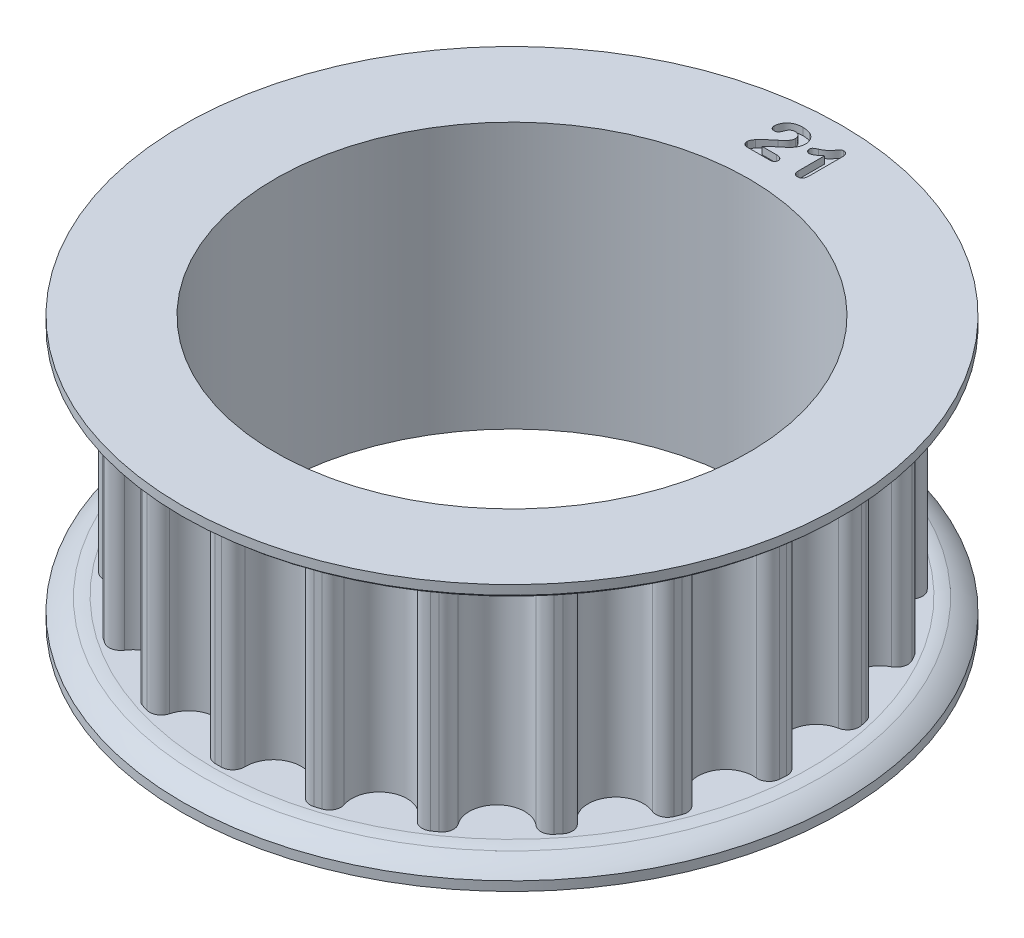
from build123d import *

# Parameters (mm, degrees)
SKETCH1_R               = 16.13976871
TOOTHOD_DEPTH           = 6.0325
TOOTHPROFILE_DEPTH      = 26.817600451
TOOTHPATTERN_COUNT      = 21
BORE_DEPTH              = 27.629782155
BORE_DEPTH_BACK         = 27.629782155
SKETCH7_R               = 13.0175
LARGE_TOOTH_COUNT_DEPTH = 0.4


with BuildPart() as part:
    # Sketch1 → ToothOD (new, symmetric)
    with BuildSketch(Plane(origin=(0, 0, 0), x_dir=(1, 0, 0), z_dir=(0, 1, 0))):
        Circle(SKETCH1_R)
    extrude(amount=TOOTHOD_DEPTH, both=True)

    # Sketch2 → ToothProfile (cut, through all)
    with BuildSketch(Plane(origin=(0, 6.0325, 0), x_dir=(1, 0, 0), z_dir=(0, 1, 0))):
        with BuildLine():
            ThreePointArc((-1.514819148, 15.428848418), (0, 14.07976871), (1.514819148, 15.428848418))
            ThreePointArc((1.514819148, 15.428848418), (1.757165873, 15.857950358), (2.233452437, 15.984486987))
            ThreePointArc((2.233452437, 15.984486987), (0, 16.13976871), (-2.233452437, 15.984486987))
            ThreePointArc((-2.233452437, 15.984486987), (-1.757165873, 15.857950358), (-1.514819148, 15.428848418))
        make_face()
    toothprofile = extrude(amount=-TOOTHPROFILE_DEPTH, mode=Mode.SUBTRACT)

    # ToothPattern: ToothProfile ×21 about axis
    toothpattern_axis = Axis((0, 6.0325, 0), (0, -1, 0))
    for i in range(1, TOOTHPATTERN_COUNT):
        add(toothprofile.rotate(toothpattern_axis, i * 360 / TOOTHPATTERN_COUNT), mode=Mode.SUBTRACT)

    # Sketch4 → Flange (revolve)
    with BuildSketch(Plane.XY):
        with BuildLine():
            Line((0, -6.0325), (16.39376871, -6.0325))
            ThreePointArc((16.39376871, -6.0325), (16.7195247, -6.058122571), (17.039341039, -6.125137424))
            ThreePointArc((17.039341039, -6.125137424), (17.607069616, -6.406697125), (18.10826871, -6.7945))
            Line((18.10826871, -6.7945), (18.10826871, -7.3025))
            Line((18.10826871, -7.3025), (0, -7.3025))
            Line((0, -7.3025), (0, -6.0325))
        make_face()
        with BuildLine():
            Line((18.10826871, 7.3025), (18.10826871, 6.7945))
            ThreePointArc((18.10826871, 6.7945), (17.607069616, 6.406697125), (17.039341039, 6.125137424))
            ThreePointArc((17.039341039, 6.125137424), (16.7195247, 6.058122571), (16.39376871, 6.0325))
            Line((16.39376871, 6.0325), (0, 6.0325))
            Line((0, 6.0325), (0, 7.3025))
            Line((0, 7.3025), (18.10826871, 7.3025))
        make_face()
    revolve(axis=Axis((0, 7.858125, 0), (0, -1, 0)))

    # Sketch7 → Bore (cut, two sides: drawn at the far end of the back side and taken through both)
    with BuildSketch(Plane.XZ.offset(-BORE_DEPTH_BACK)):
        Circle(SKETCH7_R)
    extrude(amount=BORE_DEPTH + BORE_DEPTH_BACK, mode=Mode.SUBTRACT)

    # Sketch9 → Large Tooth Count (cut)
    with BuildSketch(Plane(origin=(0, 7.3025, 0), x_dir=(1, 0, 0), z_dir=(0, 1, 0))):
        with BuildLine():
            Line((-1.17475, 14.918306129), (-0.380503906, 14.918306129))
            add(Edge.make_bspline(
                [(-0.380503906, 14.918306129), (-0.355804804, 14.917682907), (-0.309030284, 14.916502664), (-0.243428178, 14.904118762), (-0.186528488, 14.883888919), (-0.139033156, 14.85562971), (-0.101393999, 14.82140095), (-0.074037597, 14.782715406), (-0.05719802, 14.739856105), (-0.055122246, 14.709761932), (-0.054074219, 14.694567848)],
                knots=[0, 0, 0, 0, 1.343135754, 2.543595783, 3.617176489, 4.61442092, 5.531765965, 6.365790276, 7.174912707, 8, 8, 8, 8], degree=3))
            add(Edge.make_bspline(
                [(-0.054074219, 14.694567848), (-0.054802085, 14.680914227), (-0.056261987, 14.653528763), (-0.069398545, 14.613617613), (-0.090815368, 14.575898238), (-0.119929687, 14.540631431), (-0.158258195, 14.509803266), (-0.207543811, 14.48879411), (-0.265920631, 14.476030606), (-0.30799964, 14.474578885), (-0.330398438, 14.473806129)],
                knots=[0, 0, 0, 0, 0.824179157, 1.653080055, 2.512971333, 3.436438535, 4.405072091, 5.457340227, 6.646533722, 8, 8, 8, 8], degree=3))
            Line((-0.330398438, 14.473806129), (-1.536898438, 14.473806129))
            add(Edge.make_bspline(
                [(-1.536898438, 14.473806129), (-1.558472167, 14.474747701), (-1.599630029, 14.476544009), (-1.658082736, 14.490418249), (-1.709286326, 14.514606965), (-1.752624345, 14.547943859), (-1.786632726, 14.588103917), (-1.811741068, 14.63229278), (-1.827332638, 14.680148984), (-1.829165097, 14.713470809), (-1.830089844, 14.730286598)],
                knots=[0, 0, 0, 0, 1.188346208, 2.267099395, 3.286301641, 4.287122075, 5.25691743, 6.166969209, 7.074964888, 8, 8, 8, 8], degree=3))
            add(Edge.make_bspline(
                [(-1.830089844, 14.730286598), (-1.82945326, 14.742077618), (-1.82809279, 14.767276672), (-1.81802838, 14.806856447), (-1.803891207, 14.850945351), (-1.783601434, 14.897581453), (-1.760792521, 14.944322087), (-1.735670977, 14.987318721), (-1.709387952, 15.025259736), (-1.689753106, 15.047140248), (-1.680269531, 15.057708473)],
                knots=[0, 0, 0, 0, 0.772497252, 1.650934469, 2.665768415, 3.807487169, 4.98083678, 6.074173258, 7.069831195, 8, 8, 8, 8], degree=3))
            add(Edge.make_bspline(
                [(-1.680269531, 15.057708473), (-1.644035421, 15.094730938), (-1.574101955, 15.166185965), (-1.470555323, 15.267208505), (-1.374109598, 15.360134187), (-1.297309351, 15.431321971), (-1.23997077, 15.483451958), (-1.20075337, 15.517962836), (-1.165078366, 15.549658695), (-1.131700628, 15.577053388), (-1.102112959, 15.602111382), (-1.075294446, 15.623421764), (-1.051577987, 15.641444775), (-1.036380199, 15.651754679), (-1.029394531, 15.656493629)],
                knots=[0, 0, 0, 0, 2.106460972, 4.065564631, 5.88232778, 7.552435621, 8.323665149, 9.033433807, 9.676767744, 10.26395234, 10.78914621, 11.253325952, 11.656791058, 12, 12, 12, 12], degree=3))
            add(Edge.make_bspline(
                [(-1.029394531, 15.656493629), (-1.008100325, 15.67169795), (-0.966690791, 15.701264859), (-0.908607017, 15.747117736), (-0.856992368, 15.79358195), (-0.81034503, 15.839192122), (-0.769506063, 15.885410695), (-0.734191479, 15.932030152), (-0.704185654, 15.978984079), (-0.679139431, 16.025994093), (-0.660078043, 16.073185347), (-0.644945306, 16.119397262), (-0.637105315, 16.165385255), (-0.635693618, 16.19572389), (-0.635, 16.210630348)],
                knots=[0, 0, 0, 0, 1.334834965, 2.595771614, 3.772830874, 4.876488071, 5.92253324, 6.916378838, 7.85720954, 8.762924605, 9.629317751, 10.451189837, 11.239014127, 12, 12, 12, 12], degree=3))
            add(Edge.make_bspline(
                [(-0.635, 16.210630348), (-0.63557668, 16.226050246), (-0.636701897, 16.256137525), (-0.645411493, 16.30007768), (-0.659757467, 16.341594223), (-0.680292652, 16.380073347), (-0.705082453, 16.415594933), (-0.734491604, 16.446994199), (-0.768185045, 16.474008719), (-0.80541105, 16.49670422), (-0.845448109, 16.515217774), (-0.88806427, 16.527943578), (-0.932491171, 16.536334234), (-0.9628789, 16.537144845), (-0.978296875, 16.537556129)],
                knots=[0, 0, 0, 0, 1.048524963, 2.045880207, 3.035079073, 4.026514865, 5.003545842, 5.974663832, 6.942844473, 7.932746918, 8.934660944, 9.934741294, 10.952139253, 12, 12, 12, 12], degree=3))
            add(Edge.make_bspline(
                [(-0.978296875, 16.537556129), (-0.992402558, 16.537188342), (-1.020219282, 16.536463056), (-1.060692036, 16.527427481), (-1.099462324, 16.514049004), (-1.136388025, 16.495029907), (-1.171419292, 16.470300207), (-1.204536992, 16.440358877), (-1.236368104, 16.405392784), (-1.254607433, 16.378719691), (-1.264046875, 16.364915504)],
                knots=[0, 0, 0, 0, 0.968576666, 1.910054901, 2.83824492, 3.784521401, 4.756498814, 5.779585462, 6.850863807, 8, 8, 8, 8], degree=3))
            add(Edge.make_bspline(
                [(-1.264046875, 16.364915504), (-1.265923225, 16.361136697), (-1.271503607, 16.349898289), (-1.279747767, 16.325746732), (-1.294286291, 16.290144695), (-1.309714662, 16.24377585), (-1.329529783, 16.193966006), (-1.352612707, 16.145900043), (-1.379353709, 16.103035228), (-1.406692224, 16.06309583), (-1.442160272, 16.030136185), (-1.487192125, 16.00725067), (-1.541277164, 15.993950025), (-1.580142304, 15.992582957), (-1.600894531, 15.991853004)],
                knots=[0, 0, 0, 0, 0.277128514, 0.824197545, 1.674066046, 2.805212172, 4.034469565, 5.196326461, 6.303667431, 7.353778336, 8.369399301, 9.448751033, 10.637748383, 12, 12, 12, 12], degree=3))
            add(Edge.make_bspline(
                [(-1.600894531, 15.991853004), (-1.616180684, 15.99259299), (-1.646086916, 15.994040719), (-1.68905495, 16.006073427), (-1.727403458, 16.027127402), (-1.761350035, 16.054956975), (-1.789657559, 16.089748814), (-1.808718746, 16.131489991), (-1.821206006, 16.1779962), (-1.822480726, 16.210873124), (-1.823144531, 16.227993629)],
                knots=[0, 0, 0, 0, 1.006577142, 1.969294067, 2.910545259, 3.870728958, 4.847838899, 5.837573602, 6.873926541, 8, 8, 8, 8], degree=3))
            add(Edge.make_bspline(
                [(-1.823144531, 16.227993629), (-1.822436115, 16.248538841), (-1.821005637, 16.290025035), (-1.810431458, 16.352630607), (-1.794110349, 16.416281427), (-1.770911294, 16.480516181), (-1.740660207, 16.543530658), (-1.704619525, 16.604649314), (-1.660645532, 16.661587262), (-1.611959456, 16.716617549), (-1.555478935, 16.766798642), (-1.491996993, 16.812241117), (-1.421387058, 16.852186284), (-1.34403892, 16.887246276), (-1.259686643, 16.915535948), (-1.168395357, 16.935570638), (-1.07060184, 16.948364376), (-1.003143515, 16.949645717), (-0.968375, 16.950306129)],
                knots=[0, 0, 0, 0, 0.79066067, 1.596552158, 2.438066046, 3.318094126, 4.22076533, 5.12585777, 6.043865989, 6.985993145, 7.950839248, 8.945468985, 9.986194989, 11.068910188, 12.21037173, 13.404260134, 14.66213667, 16, 16, 16, 16], degree=3))
            add(Edge.make_bspline(
                [(-0.968375, 16.950306129), (-0.94620917, 16.950002663), (-0.902834011, 16.949408825), (-0.839122333, 16.945278577), (-0.778137309, 16.939154316), (-0.719915766, 16.929476196), (-0.66430709, 16.917922285), (-0.611582715, 16.902744768), (-0.561396312, 16.885744397), (-0.529574805, 16.871815781), (-0.513953125, 16.864978004)],
                knots=[0, 0, 0, 0, 1.141710532, 2.234153931, 3.287715026, 4.297387598, 5.273071892, 6.211454997, 7.121975032, 8, 8, 8, 8], degree=3))
            add(Edge.make_bspline(
                [(-0.513953125, 16.864978004), (-0.491896335, 16.854149952), (-0.448534873, 16.832863075), (-0.388351733, 16.794251079), (-0.333414408, 16.751706434), (-0.284744221, 16.704257082), (-0.241572543, 16.653370063), (-0.202858126, 16.599839334), (-0.170697232, 16.542171962), (-0.143498456, 16.482138415), (-0.122200371, 16.420139983), (-0.106821368, 16.357390392), (-0.096837838, 16.29412865), (-0.095778904, 16.251677233), (-0.09525, 16.230474098)],
                knots=[0, 0, 0, 0, 1.100471427, 2.163417708, 3.198242748, 4.209796447, 5.203380146, 6.186404149, 7.165424876, 8.157237974, 9.136931722, 10.098602738, 11.050312444, 12, 12, 12, 12], degree=3))
            add(Edge.make_bspline(
                [(-0.09525, 16.230474098), (-0.096462028, 16.197141175), (-0.098858892, 16.131223173), (-0.118864267, 16.034457512), (-0.151758446, 15.942029698), (-0.197278591, 15.855719123), (-0.248999823, 15.776702812), (-0.301239177, 15.704620585), (-0.355006619, 15.642557968), (-0.401386401, 15.596248496), (-0.441284775, 15.561653539), (-0.47465706, 15.532680027), (-0.512217664, 15.500623943), (-0.554096375, 15.465086342), (-0.600705101, 15.42675813), (-0.651145912, 15.384362227), (-0.706225706, 15.339431932), (-0.764070622, 15.292302698), (-0.82203457, 15.245004728), (-0.876250701, 15.198275543), (-0.926555501, 15.154861339), (-0.971965666, 15.113417914), (-1.012777395, 15.074343396), (-1.049949883, 15.038386386), (-1.081487811, 15.003932987), (-1.101026322, 14.981830887), (-1.110257813, 14.97138816)],
                knots=[0, 0, 0, 0, 1.436599664, 2.840968415, 4.241909903, 5.655071448, 7.037977016, 8.313294046, 9.491515882, 10.57584574, 11.13676856, 11.768818006, 12.482089669, 13.266552005, 14.137751607, 15.08474532, 16.108481255, 17.203478555, 18.302996106, 19.33499709, 20.290440541, 21.168908746, 21.986178864, 22.727567017, 23.398805086, 24, 24, 24, 24], degree=3))
            add(Edge.make_bspline(
                [(-1.110257813, 14.97138816), (-1.119582693, 14.961971916), (-1.139268779, 14.94209295), (-1.162515013, 14.926508537), (-1.17475, 14.918306129)],
                knots=[0, 0, 0, 0, 0.947357495, 2, 2, 2, 2], degree=3))
        make_face()
        with BuildLine():
            Line((0.98425, 14.737728004), (0.98425, 16.188306129))
            add(Edge.make_bspline(
                [(0.98425, 16.188306129), (0.955653295, 16.163293241), (0.90120079, 16.115664873), (0.820749887, 16.050927725), (0.745918216, 15.996031649), (0.676572168, 15.951190668), (0.61306508, 15.915919274), (0.555248961, 15.890660514), (0.502929962, 15.874322516), (0.469396805, 15.871916282), (0.453925781, 15.870806129)],
                knots=[0, 0, 0, 0, 1.452107273, 2.765034543, 3.945897232, 4.997908399, 5.920070119, 6.718510474, 7.408765629, 8, 8, 8, 8], degree=3))
            add(Edge.make_bspline(
                [(0.453925781, 15.870806129), (0.440432064, 15.871520586), (0.413883567, 15.87292626), (0.375563046, 15.8857089), (0.339846194, 15.905891291), (0.30770832, 15.933476219), (0.280417777, 15.96619313), (0.260930397, 16.003092872), (0.248219958, 16.042459537), (0.246786794, 16.069808625), (0.2460625, 16.083630348)],
                knots=[0, 0, 0, 0, 0.982678269, 1.933390929, 2.917255113, 3.962257531, 5.008793131, 6.008019064, 6.993289668, 8, 8, 8, 8], degree=3))
            add(Edge.make_bspline(
                [(0.2460625, 16.083630348), (0.246834046, 16.099068968), (0.248291393, 16.128230461), (0.258792858, 16.168932982), (0.278290386, 16.202696098), (0.306654459, 16.229579289), (0.343447705, 16.252774309), (0.3879342, 16.278340709), (0.441704967, 16.306850954), (0.481280251, 16.325259481), (0.502542969, 16.335149879)],
                knots=[0, 0, 0, 0, 0.959800551, 1.812935176, 2.587130183, 3.350598702, 4.217563363, 5.286346087, 6.542028024, 8, 8, 8, 8], degree=3))
            add(Edge.make_bspline(
                [(0.502542969, 16.335149879), (0.533494832, 16.350157346), (0.592914018, 16.378967615), (0.675454823, 16.426406272), (0.748911768, 16.474068031), (0.812802064, 16.524640609), (0.870367926, 16.577467203), (0.924276378, 16.632584456), (0.974608431, 16.691706848), (1.02053756, 16.751867945), (1.060733667, 16.808508977), (1.095799467, 16.854890336), (1.123223603, 16.889594132), (1.143837237, 16.915603016), (1.166511923, 16.932896731), (1.194799919, 16.943349095), (1.229873658, 16.949526932), (1.255582059, 16.950032402), (1.269503906, 16.950306129)],
                knots=[0, 0, 0, 0, 1.633066382, 3.135044738, 4.518110351, 5.78750681, 6.999314836, 8.226621731, 9.446368142, 10.684082489, 11.819758467, 12.744847819, 13.443941736, 13.922653104, 14.315303366, 14.780490369, 15.339600077, 16, 16, 16, 16], degree=3))
            add(Edge.make_bspline(
                [(1.269503906, 16.950306129), (1.289294139, 16.949499313), (1.327068659, 16.947959306), (1.380011686, 16.932322365), (1.425154462, 16.906011904), (1.461090797, 16.869195615), (1.489102201, 16.825922405), (1.509897216, 16.777509519), (1.521897596, 16.724005962), (1.523283606, 16.686775961), (1.524, 16.667532692)],
                knots=[0, 0, 0, 0, 1.104026993, 2.107306726, 3.052283825, 3.993636142, 4.95520013, 5.920268712, 6.92503816, 8, 8, 8, 8], degree=3))
            Line((1.524, 16.667532692), (1.524, 14.801228004))
            add(Edge.make_bspline(
                [(1.524, 14.801228004), (1.523266671, 14.773053909), (1.521889523, 14.720144613), (1.508661004, 14.646332333), (1.486737463, 14.583202414), (1.454639311, 14.531367514), (1.413153333, 14.490412111), (1.362113048, 14.46187015), (1.30218952, 14.444523958), (1.25937788, 14.442909174), (1.236761719, 14.442056129)],
                knots=[0, 0, 0, 0, 1.286563032, 2.416089802, 3.413012509, 4.323048118, 5.178141009, 6.048034207, 6.968832458, 8, 8, 8, 8], degree=3))
            add(Edge.make_bspline(
                [(1.236761719, 14.442056129), (1.218631899, 14.442964715), (1.183574254, 14.444721649), (1.133790925, 14.459584706), (1.089598648, 14.483898343), (1.051422973, 14.517558133), (1.020446958, 14.560602509), (0.999661757, 14.61273658), (0.98644056, 14.672582925), (0.985008893, 14.71515928), (0.98425, 14.737728004)],
                knots=[0, 0, 0, 0, 0.988661812, 1.911776046, 2.809258143, 3.724383738, 4.669377512, 5.677528055, 6.768912233, 8, 8, 8, 8], degree=3))
        make_face()
    extrude(amount=-LARGE_TOOTH_COUNT_DEPTH, mode=Mode.SUBTRACT)


solid = part.part
